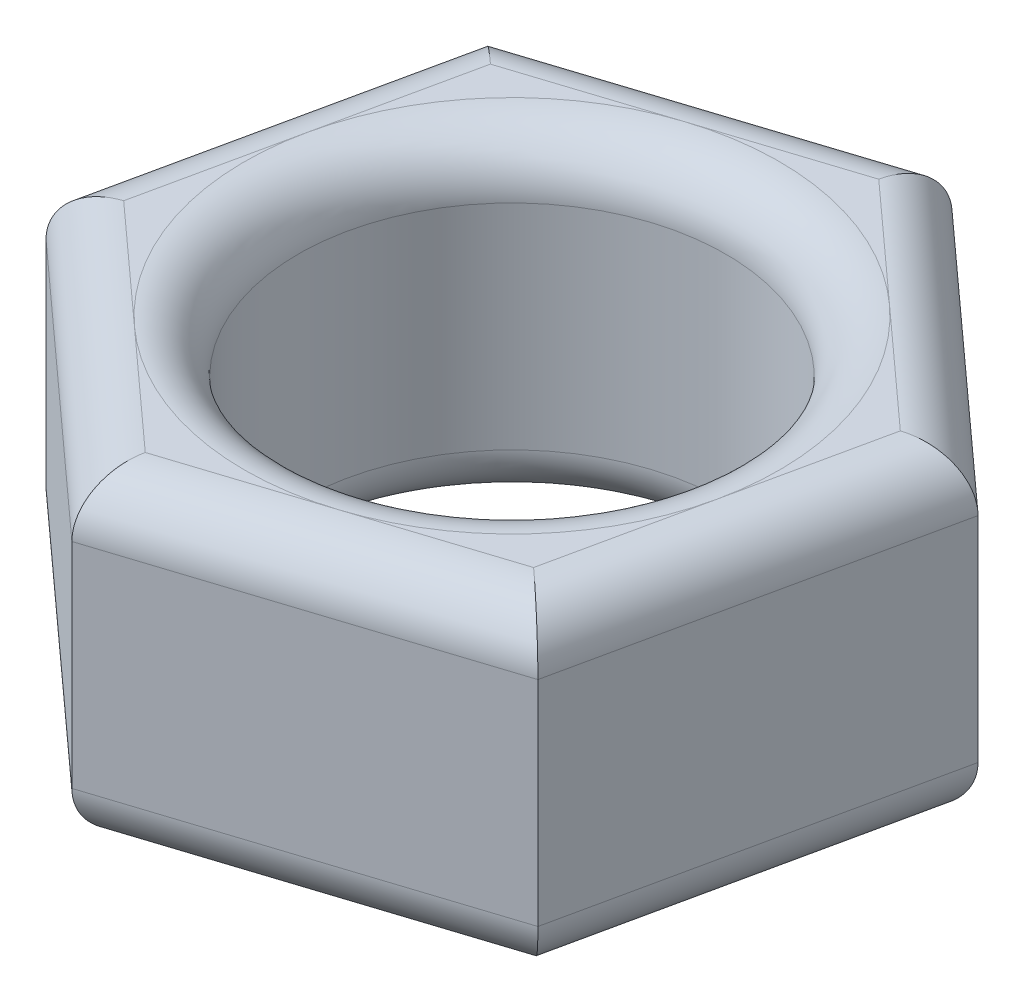
from build123d import *

# Parameters (mm, degrees)
SKETCH1_R           = 4
BOSS_EXTRUDE1_DEPTH = 6
FILLET1_R           = 1


with BuildPart() as part:
    # Sketch1 → Boss-Extrude1 (new body)
    with BuildSketch(Plane(origin=(0, 0, 0), x_dir=(1, 0, 0), z_dir=(0, 1, 0))):
        Polygon((-5.135167492, 4.650812276), (-6.595305325, -2.121779363), (-1.460137834, -6.772591639), (5.135167492, -4.650812276), (6.595305325, 2.121779363), (1.460137834, 6.772591639), align=None)
        with Locations(Location((0, 0, 0), (0, 0, 270))):
            Circle(SKETCH1_R, mode=Mode.SUBTRACT)
    extrude(amount=BOSS_EXTRUDE1_DEPTH)

    # Fillet1
    fillet1_edges = [part.edges().sort_by_distance(p)[0] for p in [
        (-4.02772158, 6, 4.447185501),
        (1.837514829, 6, 5.711701958),
        (5.865236409, 6, 1.264516457),
        (0, 0, -4),
        (0, 6, -4),
        (4.02772158, 6, -4.447185501),
        (-1.837514829, 6, -5.711701958),
        (4.02772158, 0, -4.447185501),
        (5.865236409, 0, 1.264516457),
        (1.837514829, 0, 5.711701958),
        (-5.865236409, 6, -1.264516457),
        (-4.02772158, 0, 4.447185501),
        (-5.865236409, 0, -1.264516457),
        (-1.837514829, 0, -5.711701958),
    ]]
    fillet(fillet1_edges, radius=FILLET1_R - 0.0001)  # a hair under: the kernel refuses the full size


solid = part.part
